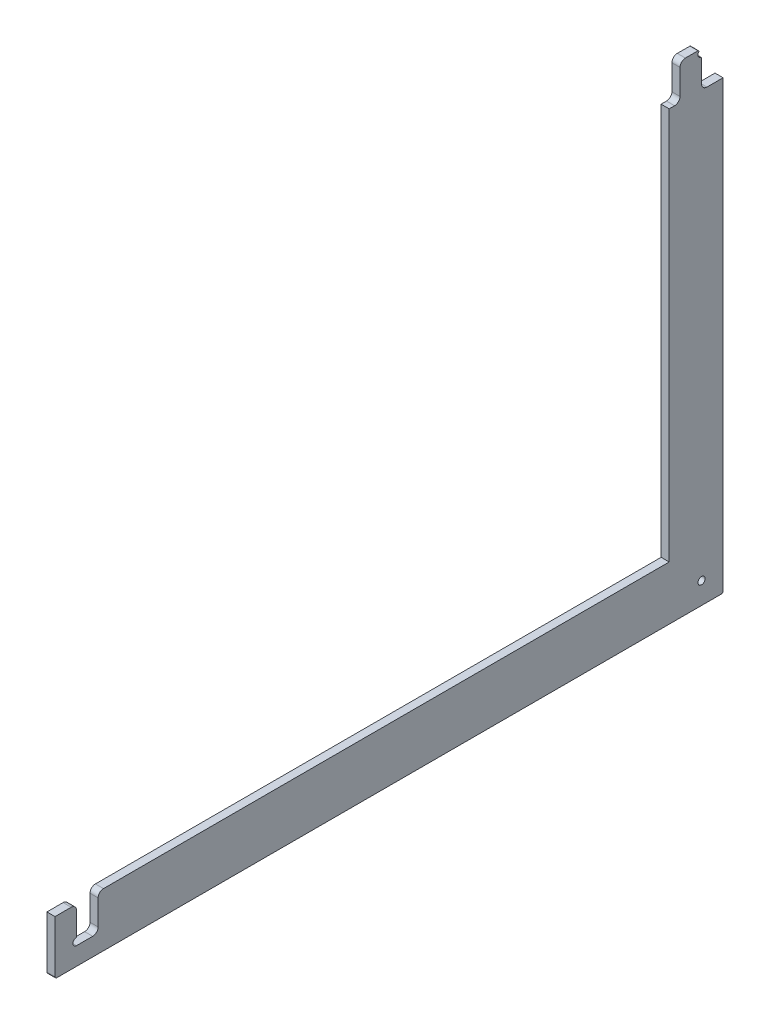
from build123d import *

# Parameters (mm, degrees)
SKETCH2_R           = 2
BOSS_EXTRUDE1_DEPTH = 4.5
SKETCH3_R           = 2
CUT_EXTRUDE1_DEPTH  = 459.798975587
FILLET2_R           = 0.5
FILLET4_R           = 0.5
FILLET5_R           = 0.5
FILLET6_R           = 3
FILLET7_R           = 3
FILLET8_R           = 1


with BuildPart() as part:
    # Sketch2 → Boss-Extrude1 (new body)
    with BuildSketch(Plane(origin=(0, 0, 0), x_dir=(0, 0, -1), z_dir=(1, 0, 0))):
        Polygon((-30, 30), (-30, 248.5), (-24, 248.5), (-24, 268.5), (-12, 268.5), (-12, 248.5), (0, 248.5), (0, 0), (-372, 0), (-372, 30), (-360, 30), (-360, 10), (-348, 10), (-348, 30), align=None)
        with Locations((-12, 12)):
            Circle(SKETCH2_R, mode=Mode.SUBTRACT)
    extrude(amount=BOSS_EXTRUDE1_DEPTH)

    # Sketch3 → Cut-Extrude1 (cut, through all)
    with BuildSketch(Plane(origin=(4.5, 0, 0), x_dir=(0, 0, -1), z_dir=(1, 0, 0))):
        with Locations((-12, 266.5)):
            Circle(SKETCH3_R)
        with Locations((-360, 12)):
            Circle(SKETCH3_R)
    extrude(amount=-CUT_EXTRUDE1_DEPTH, mode=Mode.SUBTRACT)

    # Fillet2
    fillet2_edges = [part.edges().sort_by_distance(p)[0] for p in [
        (2.25, 264.5, 12),
    ]]
    fillet(fillet2_edges, radius=FILLET2_R)

    # Fillet4
    fillet4_edges = [part.edges().sort_by_distance(p)[0] for p in [
        (2.25, 268.5, 12),
    ]]
    fillet(fillet4_edges, radius=FILLET4_R)

    # Fillet5
    fillet5_edges = [part.edges().sort_by_distance(p)[0] for p in [
        (2.25, 14, 360),
    ]]
    fillet(fillet5_edges, radius=FILLET5_R)

    # Fillet6
    fillet6_edges = [part.edges().sort_by_distance(p)[0] for p in [
        (2.25, 248.5, 24),
        (2.25, 248.5, 12),
        (2.25, 30, 348),
        (2.25, 30, 360),
    ]]
    fillet(fillet6_edges, radius=FILLET6_R)

    # Fillet7
    fillet7_edges = [part.edges().sort_by_distance(p)[0] for p in [
        (2.25, 10, 348),
        (2.25, 268.5, 24),
    ]]
    fillet(fillet7_edges, radius=FILLET7_R)

    # Fillet8
    fillet8_edges = [part.edges().sort_by_distance(p)[0] for p in [
        (2.25, 0, 372),
        (2.25, 0, 0),
    ]]
    fillet(fillet8_edges, radius=FILLET8_R)


solid = part.part
